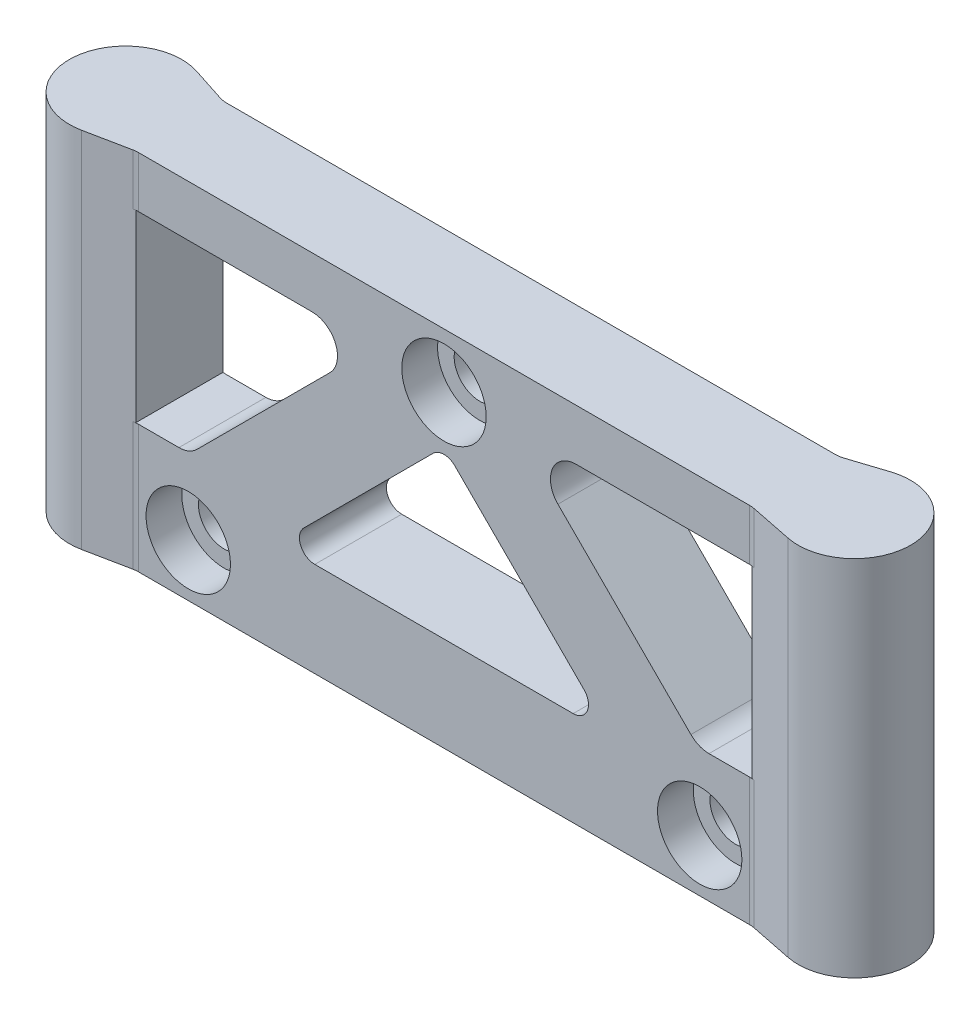
from build123d import *
from build123d.topology import SkipClean

# Parameters (mm, degrees)
BOSS_EXTRUDE4_DEPTH      = 17
SKETCH3_R                = 8.25
CUT_EXTRUDE1_DEPTH       = 7
CUT_EXTRUDE2_START       = -7
SKETCH4_R                = 8.25
CUT_EXTRUDE2_DEPTH       = 7
CUT_EXTRUDE3_DEPTH       = 127.783772621
SKETCH6_R                = 5
CUT_EXTRUDE4_DEPTH       = 16.6
FILLET1_R                = 3
BOSS_EXTRUDE5_DEPTH      = 17
BOSS_EXTRUDE6_DEPTH      = 46
BOSS_EXTRUDE6_DEPTH_BACK = 25
SKETCH8_R                = 8.25
BOSS_EXTRUDE7_REACH      = 138.278
SKETCH9_W                = 17
SKETCH9_H                = 10
FILLET2_R                = 5
FILLET5_R                = 5
SKETCH10_W               = 60.25
SKETCH10_H               = 70.5
CUT_EXTRUDE5_DEPTH       = 128.305243411
BOSS_EXTRUDE8_DEPTH      = 17
BOSS_EXTRUDE9_START      = -20
SKETCH12_R               = 11
BOSS_EXTRUDE9_DEPTH      = 20


with BuildPart() as part:
    # Sketch2 → Boss-Extrude4 (new body)
    with BuildSketch(Plane.XY):
        with BuildLine():
            Line((-57.247844507, 57.247844507), (-107.247844507, 7.247844507))
            ThreePointArc((-107.247844507, 7.247844507), (-109.469765208, -3.922505182), (-100, -10.25))
            Line((-100, -10.25), (0, -10.25))
            ThreePointArc((0, -10.25), (9.469765208, -3.922505182), (7.247844507, 7.247844507))
            Line((7.247844507, 7.247844507), (-42.752155493, 57.247844507))
            ThreePointArc((-42.752155493, 57.247844507), (-50, 60.25), (-57.247844507, 57.247844507))
        make_face()
        Polygon((-75.254310986, 10.25), (-50, 35.504310986), (-24.745689014, 10.25), align=None, mode=Mode.SUBTRACT)
    extrude(amount=BOSS_EXTRUDE4_DEPTH)

    # Sketch3 → Cut-Extrude1 (cut)
    with BuildSketch(Plane(origin=(0, 0, 0), x_dir=(-1, 0, 0), z_dir=(0, 0, -1))):
        Circle(SKETCH3_R)
        with Locations((50, 50)):
            Circle(SKETCH3_R)
        with Locations((100, 0)):
            Circle(SKETCH3_R)
    extrude(amount=-CUT_EXTRUDE1_DEPTH, mode=Mode.SUBTRACT)

    # Sketch4 → Cut-Extrude2 (cut)
    with BuildSketch(Plane.XY.offset(17).offset(CUT_EXTRUDE2_START)):
        with Locations((-100, 0)):
            Circle(SKETCH4_R)
        with Locations((-50, 50)):
            Circle(SKETCH4_R)
        Circle(SKETCH4_R)
    extrude(amount=CUT_EXTRUDE2_DEPTH, mode=Mode.SUBTRACT)

    # Sketch5 → Cut-Extrude3 (cut, through all)
    with BuildSketch(Plane(origin=(0, 0, 0), x_dir=(-1, 0, 0), z_dir=(0, 0, -1))):
        Polygon((17.5, 8.25), (50, 40.75), (82.5, 8.25), align=None)
    extrude(amount=-CUT_EXTRUDE3_DEPTH, mode=Mode.SUBTRACT)

    # Sketch6 → Cut-Extrude4 (cut)
    with BuildSketch(Plane.XY.offset(17)):
        with Locations((-100, 0)):
            Circle(SKETCH6_R)
        with Locations((-50, 50)):
            Circle(SKETCH6_R)
        Circle(SKETCH6_R)
    extrude(amount=-CUT_EXTRUDE4_DEPTH, mode=Mode.SUBTRACT)

    # Fillet1
    fillet1_edges = [part.edges().sort_by_distance(p)[0] for p in [
        (-82.5, 8.25, 8.5),
        (-17.5, 8.25, 8.5),
        (-50, 40.75, 8.5),
    ]]
    fillet(fillet1_edges, radius=FILLET1_R)

    # Sketch7 → Boss-Extrude5 (add)
    with BuildSketch(Plane(origin=(0, 0, 0), x_dir=(-1, 0, 0), z_dir=(0, 0, -1))):
        with BuildLine():
            Line((-10.25, -10.25), (0, -10.25))
            ThreePointArc((0, -10.25), (-7.247844507, -7.247844507), (-10.25, 0))
            Line((-10.25, 0), (-10.25, -10.25))
        make_face()
        with BuildLine():
            Line((-10.25, 14.75), (-10.25, 0))
            ThreePointArc((-10.25, 0), (-9.469765208, 3.922505182), (-7.247844507, 7.247844507))
            Line((-7.247844507, 7.247844507), (0.254310986, 14.75))
            Line((0.254310986, 14.75), (-10.25, 14.75))
        make_face()
    extrude(amount=-BOSS_EXTRUDE5_DEPTH)

    # Sketch8 → Boss-Extrude6 (add, two sides: drawn at the far end of the back side and taken through both)
    with BuildSketch(Plane(origin=(0, 14.75, 0), x_dir=(1, 0, 0), z_dir=(0, 1, 0)).offset(-BOSS_EXTRUDE6_DEPTH_BACK)):
        with BuildLine():
            Line((10.25, -17), (19.071782178, -18.782178218))
            ThreePointArc((19.071782178, -18.782178218), (32.232177159, -7.374072804), (17.860810811, 2.464864865))
            Line((17.860810811, 2.464864865), (10.25, 0))
            Line((10.25, 0), (10.25, -17))
        make_face()
        with Locations((21.25, -8)):
            Circle(SKETCH8_R, mode=Mode.SUBTRACT)
    extrude(amount=BOSS_EXTRUDE6_DEPTH + BOSS_EXTRUDE6_DEPTH_BACK)

    # Boss-Extrude7: up to this plane
    boss_extrude7_end = Plane(origin=(7.247844507, 7.247844507, 17), z_dir=(-0.7071067811865439, -0.7071067811865512, 0))
    # Sketch9 → Boss-Extrude7 (add, up to the surface)
    with BuildSketch(Plane.ZY.offset(-10.25), mode=Mode.PRIVATE) as boss_extrude7_sk1:
        with Locations((8.5, 55.75)):
            Rectangle(SKETCH9_W, SKETCH9_H)
    boss_extrude7_tool1 = split(extrude(boss_extrude7_sk1.sketch, amount=BOSS_EXTRUDE7_REACH, mode=Mode.PRIVATE), bisect_by=boss_extrude7_end, keep=Keep.BOTH, mode=Mode.PRIVATE)
    add(boss_extrude7_tool1.solids().sort_by_distance((10.25, 55.75, 8.5))[0])

    # Fillet2
    fillet2_edges = [part.edges().sort_by_distance(p)[0] for p in [
        (10.25, 2.25, 0),
        (10.25, 55.75, 0),
        (10.25, 55.75, 17),
        (10.25, 2.25, 17),
    ]]
    fillet(fillet2_edges, radius=FILLET2_R)

    # Fillet5
    fillet5_edges = [part.edges().sort_by_distance(p)[0] for p in [
        (-36.254310986, 50.75, 8.5),
        (-0.254310986, 14.75, 8.5),
    ]]
    fillet(fillet5_edges, radius=FILLET5_R)

    # Sketch10 → Cut-Extrude5 (cut, through all)
    with BuildSketch(Plane(origin=(0, 0, 0), x_dir=(-1, 0, 0), z_dir=(0, 0, -1))):
        with Locations((80.125, 25)):
            Rectangle(SKETCH10_W, SKETCH10_H)
    extrude(amount=-CUT_EXTRUDE5_DEPTH, mode=Mode.SUBTRACT)

    # Mirror1: part across plane


with BuildPart() as part_1:
    with SkipClean():  # the faces are left unmerged after this step: merging them gives an invalid solid
        add(part.part)
        add(part.part.mirror(Plane(origin=(-50, -10.25, 19), x_dir=(0, 0, 1), z_dir=(1, 0, 0))))

    # Sketch11 → Boss-Extrude8 (add)
    with SkipClean():  # the faces are left unmerged after this step: merging them gives an invalid solid
        with BuildSketch(Plane(origin=(0, 0, 0), x_dir=(-1, 0, 0), z_dir=(0, 0, -1))):
            with BuildLine():
                Line((53.745689014, 60.75), (46.254310986, 60.75))
                Line((46.254310986, 60.75), (42.752155493, 57.247844507))
                ThreePointArc((42.752155493, 57.247844507), (50, 60.25), (57.247844507, 57.247844507))
                Line((57.247844507, 57.247844507), (53.745689014, 60.75))
            make_face()
        extrude(amount=-BOSS_EXTRUDE8_DEPTH)

    # Sketch12 → Boss-Extrude9 (add)
    with SkipClean():  # the faces are left unmerged after this step: merging them gives an invalid solid
        with BuildSketch(Plane(origin=(0, 60.75, 0), x_dir=(1, 0, 0), z_dir=(0, 1, 0)).offset(BOSS_EXTRUDE9_START)):
            with Locations((-121.25, -8)):
                Circle(SKETCH12_R)
            with Locations((21.25, -8)):
                Circle(SKETCH12_R)
        extrude(amount=BOSS_EXTRUDE9_DEPTH)


solid = part_1.part
